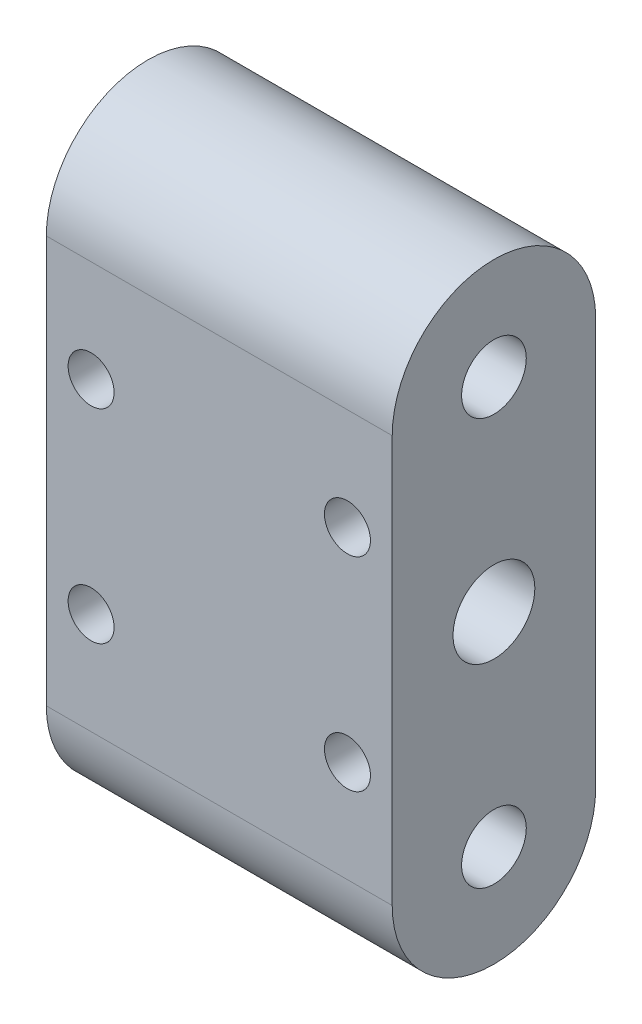
from build123d import *

# Parameters (mm, degrees)
BOSS_EXTRUDE1_DEPTH     = 21.59
F_1_4_20_TAPPED_HOLE1_D = 5.1054
F_10_32_TAPPED_HOLE1_D  = 4.0386
F_6_40_TAPPED_HOLE1_D   = 2.8702


with BuildPart() as part:
    # Sketch1 → Boss-Extrude1 (new body)
    with BuildSketch(Plane(origin=(0, 0, 0), x_dir=(0, 0, -1), z_dir=(1, 0, 0))):
        with BuildLine():
            Line((6.35, 12.7), (6.35, -12.7))
            ThreePointArc((6.35, -12.7), (0, -19.05), (-6.35, -12.7))
            Line((-6.35, -12.7), (-6.35, 12.7))
            ThreePointArc((-6.35, 12.7), (0, 19.05), (6.35, 12.7))
        make_face()
    extrude(amount=BOSS_EXTRUDE1_DEPTH)

    # 1/4-20 Tapped Hole1 (through all)
    with Locations(Plane(origin=(21.59, 0, 0), x_dir=(0, 0, -1), z_dir=(1, 0, 0))):
        with Locations((0, 0)):
            Hole(F_1_4_20_TAPPED_HOLE1_D / 2)

    # #10-32 Tapped Hole1 (through all)
    with Locations(Plane(origin=(21.59, 0, 0), x_dir=(0, 0, -1), z_dir=(1, 0, 0))):
        with Locations((0, 12.7), (0, -12.7)):
            Hole(F_10_32_TAPPED_HOLE1_D / 2)

    # #6-40 Tapped Hole1 (through all)
    with Locations(Plane.XY.offset(6.35)):
        with Locations((2.795, 6.35), (18.795, 6.35), (2.795, -6.35), (18.795, -6.35)):
            Hole(F_6_40_TAPPED_HOLE1_D / 2)


solid = part.part
